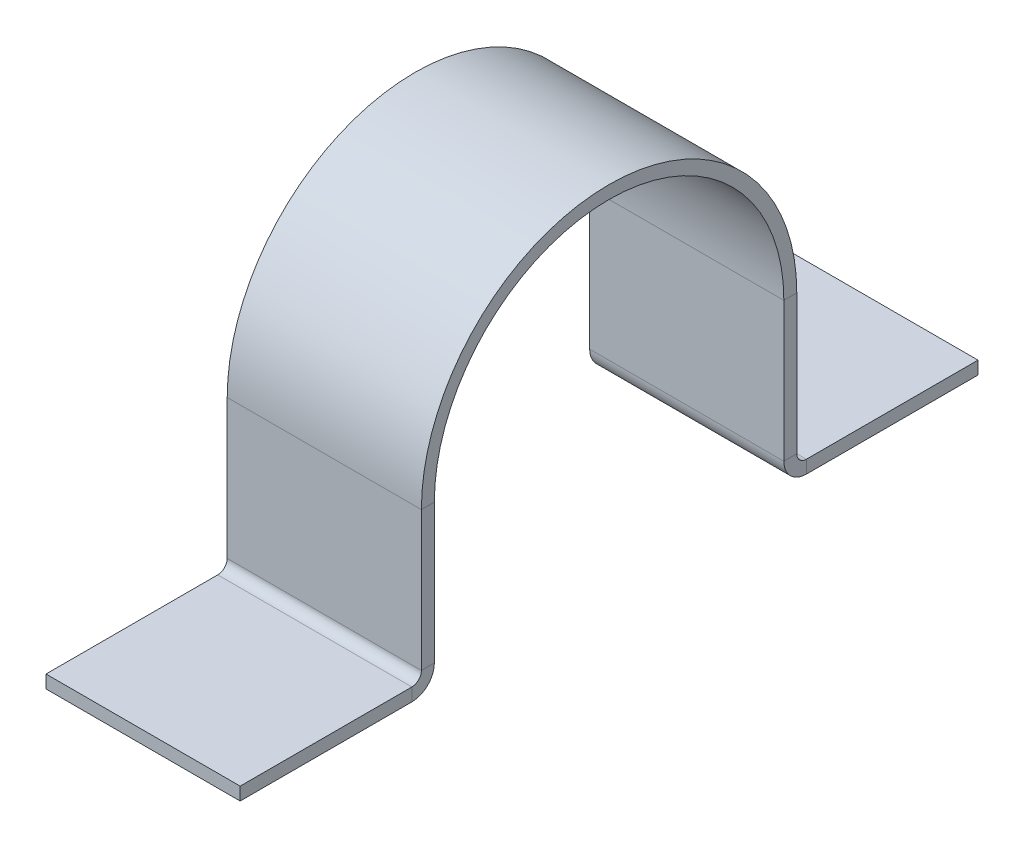
from build123d import *

# Parameters (mm, degrees)
BASE_FLANGE1_DEPTH = 7.5


# Sheet-metal steps are written as plain solids
with BuildPart() as part:
    # Sketch1 → Base-Flange1 (new, symmetric)
    with BuildSketch(Plane(origin=(0, 0, 0), x_dir=(0, 0, -1), z_dir=(1, 0, 0))):
        with BuildLine():
            Line((31.413560175, -7.925529264), (18.150160175, -7.925529264))
            ThreePointArc((18.150160175, -7.925529264), (16.922198539, -7.416890901), (16.413560175, -6.188929264))
            Line((16.413560175, -6.188929264), (16.413560175, 4.574470736))
            ThreePointArc((16.413560175, 4.574470736), (2.913560175, 18.074470736), (-10.586439825, 4.574470736))
            Line((-10.586439825, 4.574470736), (-10.586439825, -6.188929264))
            ThreePointArc((-10.586439825, -6.188929264), (-11.095078189, -7.416890901), (-12.323039825, -7.925529264))
            Line((-12.323039825, -7.925529264), (-25.586439825, -7.925529264))
            Line((-25.586439825, -7.925529264), (-25.586439825, -6.925529264))
            Line((-25.586439825, -6.925529264), (-12.323039825, -6.925529264))
            ThreePointArc((-12.323039825, -6.925529264), (-11.80218497, -6.709784119), (-11.586439825, -6.188929264))
            Line((-11.586439825, -6.188929264), (-11.586439825, 4.574470736))
            ThreePointArc((-11.586439825, 4.574470736), (2.913560175, 19.074470736), (17.413560175, 4.574470736))
            Line((17.413560175, 4.574470736), (17.413560175, -6.188929264))
            ThreePointArc((17.413560175, -6.188929264), (17.62930532, -6.709784119), (18.150160175, -6.925529264))
            Line((18.150160175, -6.925529264), (31.413560175, -6.925529264))
            Line((31.413560175, -6.925529264), (31.413560175, -7.925529264))
        make_face()
    extrude(amount=BASE_FLANGE1_DEPTH, both=True)


solid = part.part
